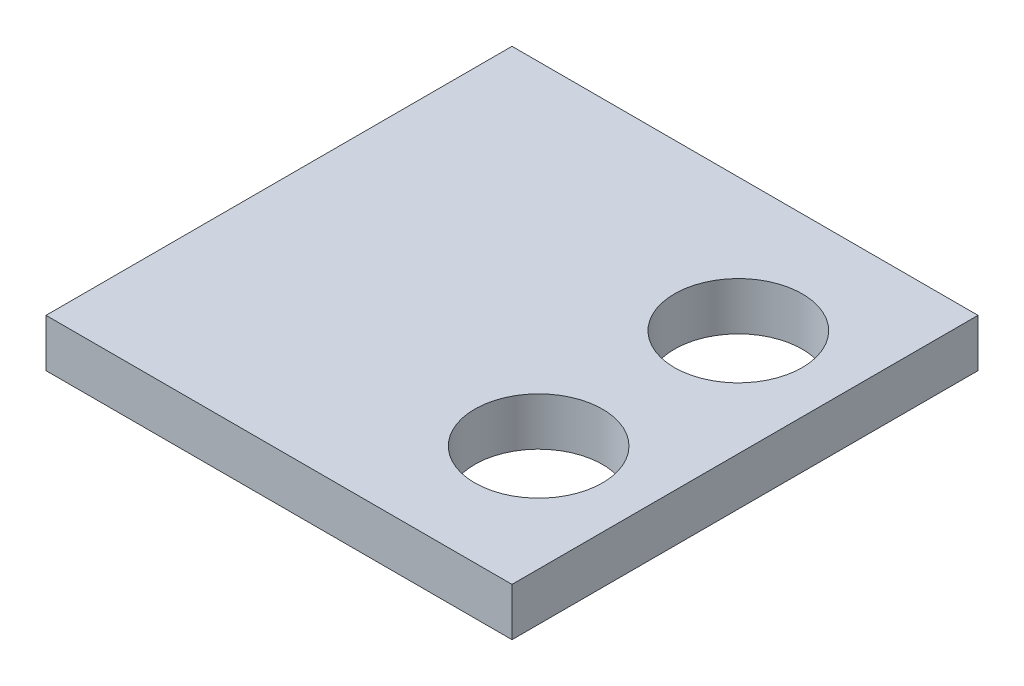
from build123d import *

# Parameters (mm, degrees)
SKETCH1_W             = 8.89
SKETCH1_H             = 8.89
BASE_FLANGE1_DEPTH    = 0.9144
F_2_CLEARANCE_HOLE1_D = 2.4384


# Sheet-metal steps are written as plain solids
with BuildPart() as part:
    # Sketch1 → Base-Flange1 (new body)
    with BuildSketch(Plane(origin=(0, 0, 0), x_dir=(1, 0, 0), z_dir=(0, 1, 0))):
        with Locations((4.445, 4.445)):
            Rectangle(SKETCH1_W, SKETCH1_H)
    extrude(amount=-BASE_FLANGE1_DEPTH)

    # #2 Clearance Hole1 (through all)
    with Locations(Plane(origin=(0, 0, 0), x_dir=(1, 0, 0), z_dir=(0, 1, 0))):
        with Locations((6.858, 2.54), (6.858, 6.35)):
            Hole(F_2_CLEARANCE_HOLE1_D / 2)


solid = part.part
